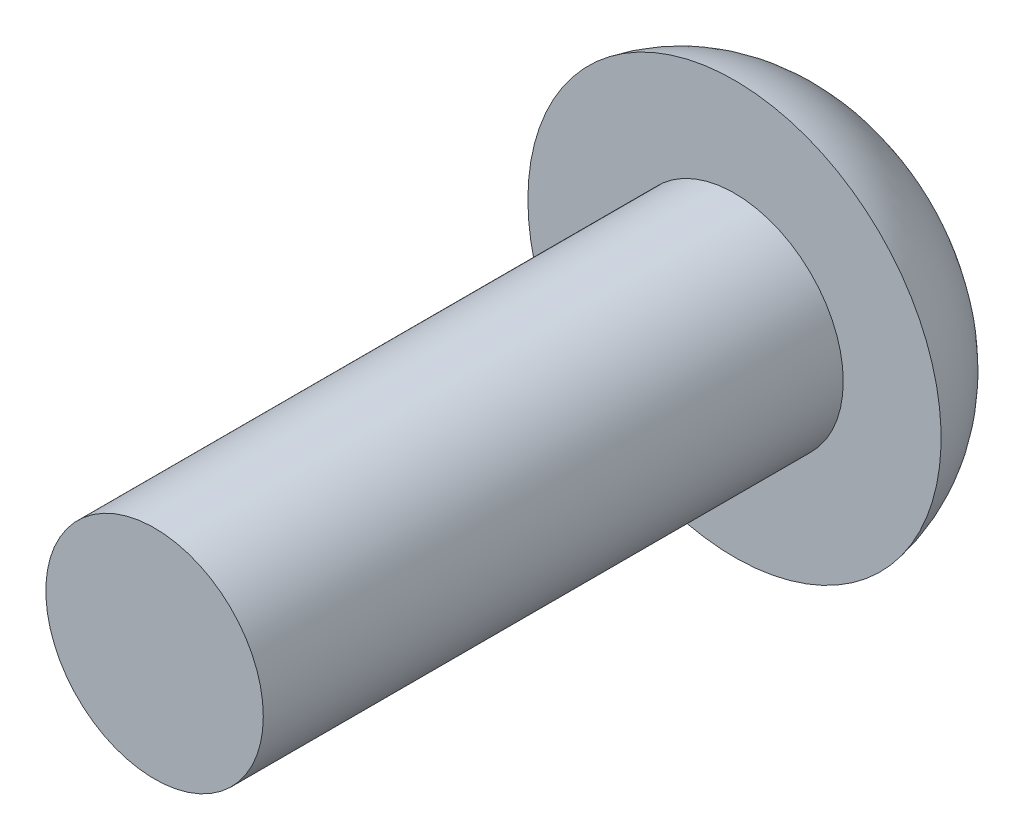
from build123d import *

# Parameters (mm, degrees)
SKETCH_1_R      = 1.5
EXTRUDE_1_DEPTH = 8
SKETCH_2_R      = 2.85
EXTRUDE_2_DEPTH = 1.65
FILLET_1_R      = 2


with BuildPart() as part:
    # 草图1 → 凸台-拉伸1 (new body)
    with BuildSketch(Plane.XY):
        Circle(SKETCH_1_R)
    extrude(amount=EXTRUDE_1_DEPTH)

    # 草图2 → 凸台-拉伸2 (add)
    with BuildSketch(Plane(origin=(0, 0, 0), x_dir=(-1, 0, 0), z_dir=(0, 0, -1))):
        Circle(SKETCH_2_R)
    extrude(amount=EXTRUDE_2_DEPTH)

    # 圆角1
    # the kernel refuses this fillet: 2 mm, written as the material it takes off along each edge
    with BuildSketch(Plane(origin=(0, 0, -1.65), x_dir=(-1, 0, 0), z_dir=(0, -1, 0))) as fillet_1_piece_1:
        with BuildLine():
            CenterArc((0.880863133, -2), FILLET_1_R, 10.078658108, 79.921341892)
            Line((0.880863133, 0), (0.880863133, 0.04))
            Line((0.880863133, 0.04), (2.85, 0.04))
            Line((2.85, 0.04), (2.89, 0))
            ThreePointArc((2.89, 0), (2.89, -0.825), (2.889382737, -1.643))
            Line((2.889382737, -1.643), (2.85, -1.65))
        make_face()
    revolve(axis=Axis((0, 0, -1.65), (0, 0, -1)), mode=Mode.SUBTRACT)


solid = part.part
